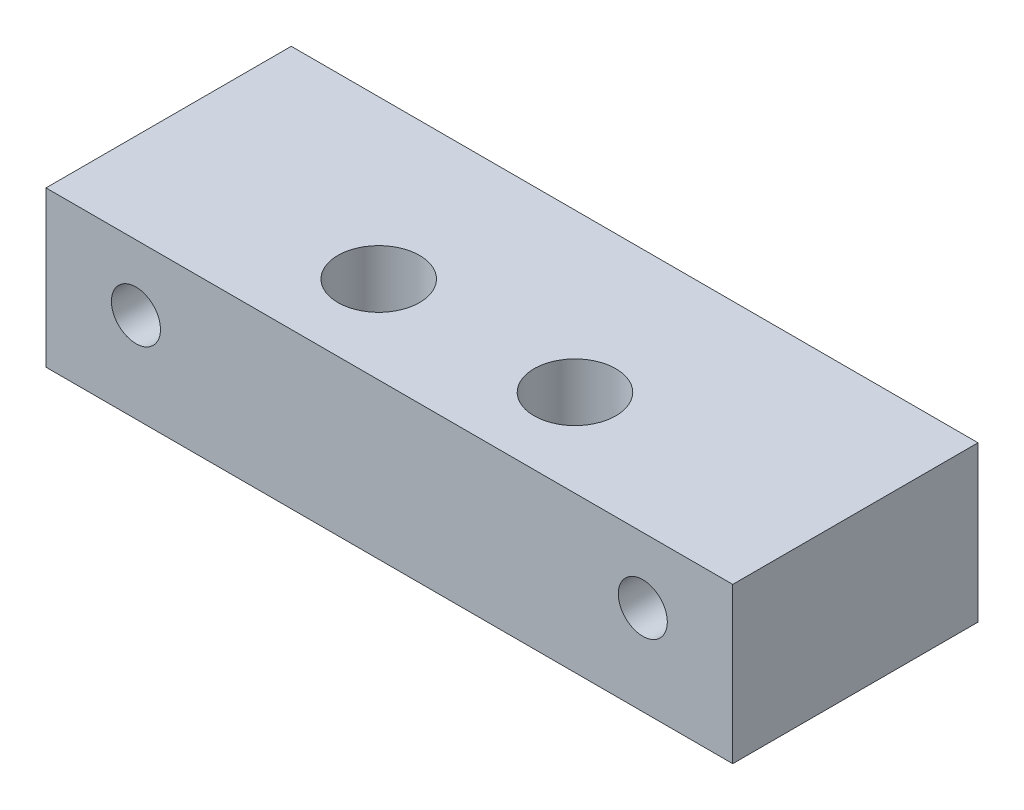
from build123d import *

# Parameters (mm, degrees)
SKETCH1_W           = 42
SKETCH1_H           = 15
BOSS_EXTRUDE1_DEPTH = 9.5
SKETCH2_R           = 2.5
CUT_EXTRUDE1_DEPTH  = 25.238399287
SKETCH3_R           = 1.5
CUT_EXTRUDE2_DEPTH  = 28.5


with BuildPart() as part:
    # Sketch1 → Boss-Extrude1 (new body)
    with BuildSketch(Plane(origin=(0, 0, 0), x_dir=(1, 0, 0), z_dir=(0, 1, 0))):
        Rectangle(SKETCH1_W, SKETCH1_H)
    extrude(amount=BOSS_EXTRUDE1_DEPTH)

    # Sketch2 → Cut-Extrude1 (cut, through all)
    with BuildSketch(Plane(origin=(0, 9.5, 0), x_dir=(1, 0, 0), z_dir=(0, 1, 0))):
        with Locations((-6, -2.15)):
            Circle(SKETCH2_R)
        with Locations((6, -2.15)):
            Circle(SKETCH2_R)
    extrude(amount=-CUT_EXTRUDE1_DEPTH, mode=Mode.SUBTRACT)

    # Sketch3 → Cut-Extrude2 (cut, through all)
    with BuildSketch(Plane.XY.offset(7.5)):
        with Locations((-15.5, 5.5)):
            Circle(SKETCH3_R)
        with Locations((15.5, 5.5)):
            Circle(SKETCH3_R)
    extrude(amount=-CUT_EXTRUDE2_DEPTH, mode=Mode.SUBTRACT)


solid = part.part
